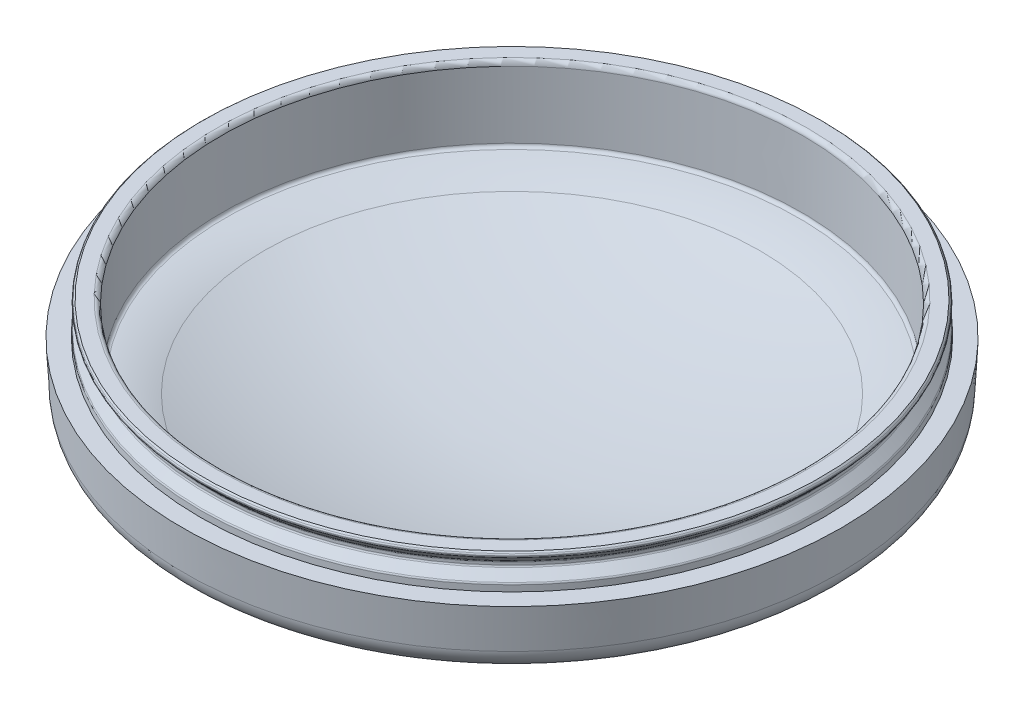
from build123d import *

# Parameters (mm, degrees)
SHELL1_T  = -1
FILLET2_R = 0.15
FILLET3_R = 0.2
FILLET4_R = 0.1


with BuildPart() as part:
    # Sketch3 → Revolve1 (revolve)
    with BuildSketch(Plane.XY, mode=Mode.PRIVATE) as revolve1_sk:
        with BuildLine():
            Line((0, 0), (-14.71721203, 0))
            Line((-14.71721203, 0), (-14.622669519, -1.803978578))
            ThreePointArc((-14.622669519, -1.803978578), (-14.304496998, -2.48443062), (-13.602377467, -2.751407959))
            ThreePointArc((-13.602377467, -2.751407959), (-12.49173295, -2.830685215), (-11.414862037, -3.113819746))
            ThreePointArc((-11.414862037, -3.113819746), (-5.795969269, -4.623740658), (0, -5.132225985))
            Line((0, -5.132225985), (0, 0))
        make_face()
    revolve(revolve1_sk.sketch.rotate(Axis((0, -5.132225985, 0), (0, 1, 0)), 180), axis=Axis((0, -5.132225985, 0), (0, 1, 0)))

    # Shell1
    shell1_openings = [part.faces().sort_by_distance(p)[0] for p in [
        (0, 0, 0),
    ]]
    offset(amount=SHELL1_T, openings=shell1_openings, kind=Kind.INTERSECTION)

    # Fillet1: read off the stored shape, not the designer's step
    # Fillet1 outline → Fillet1 (revolve)
    with BuildSketch(Plane.XY):
        with BuildLine():
            Line((13.648593596, -1.756499566), (13.648593596, -1.283131799))
            ThreePointArc((13.648593596, -1.283131799), (13.501190879, -1.612150966), (13.170820397, -1.756499566))
            Line((13.170820397, -1.756499566), (13.648593596, -1.756499566))
        make_face()
    revolve(axis=Axis((0, 0, 0), (0, 1, 0)))

    # Sketch4 → Revolve2 (revolve)
    with BuildSketch(Plane.XY, mode=Mode.PRIVATE) as revolve2_sk:
        Polygon((-13, 1.5), (-12.938907273, -2), (-13.95, -2), (-13.909682207, 0.309804838), (-13.502762166, 0.702762954), (-13.499271685, 0.902732493), (-13.8922298, 1.309652533), (-13.890484559, 1.409637303), (-13.800121862, 1.5), align=None)
    revolve(revolve2_sk.sketch.rotate(Axis((0, 0, 0), (0, 1, 0)), 270), axis=Axis((0, 0, 0), (0, 1, 0)))

    # Fillet2
    fillet2_edges = [part.edges().sort_by_distance(p)[0] for p in [
        (-9.152027206, -1.770053761, 9.152027206),
        (9.152027207, -1.770053761, -9.152027207),
    ]]
    fillet(fillet2_edges, radius=FILLET2_R)

    # Fillet3
    fillet3_edges = [part.edges().sort_by_distance(p)[0] for p in [
        (0, 1.5, 13),
    ]]
    fillet(fillet3_edges, radius=FILLET3_R)

    # Fillet4
    fillet4_edges = [part.edges().sort_by_distance(p)[0] for p in [
        (0, 0.309804838, 13.909682207),
        (0, 1.409637303, 13.890484559),
        (0, 1.309652533, 13.8922298),
        (0, 0.902732493, 13.499271685),
        (0, 0.702762954, 13.502762166),
    ]]
    fillet(fillet4_edges, radius=FILLET4_R)


solid = part.part
